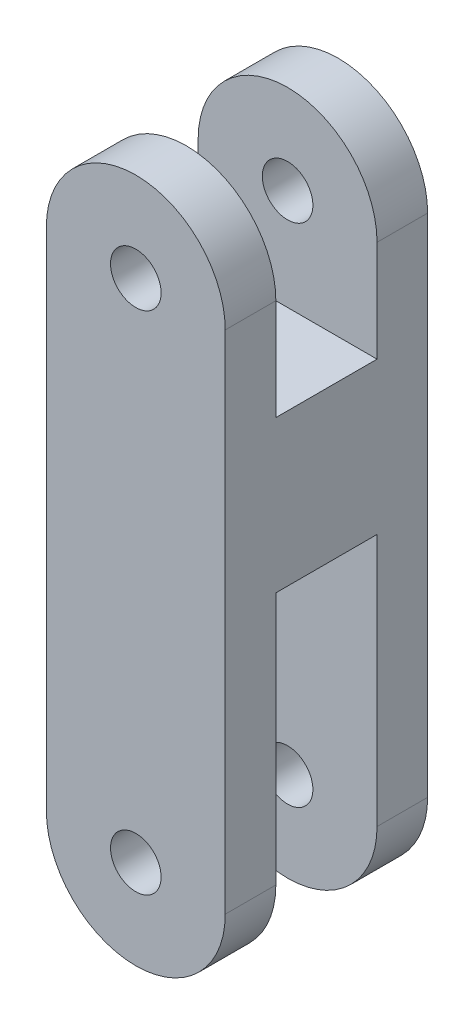
from build123d import *

# Parameters (mm, degrees)
BOSS_EXTRUDE2_DEPTH            = 40
BOSS_EXTRUDE2_DEPTH_BACK       = 40
SKETCH2_R                      = 10
CUT_EXTRUDE1_DEPTH             = 20
CUT_EXTRUDE1_DEPTH_BACK        = 20
CUT_EXTRUDE2_REACH             = 311.987
SKETCH4_W                      = 70.710678118
SKETCH4_H                      = 60
CUT_EXTRUDE2_DIRECTION_2_REACH = 311.987
SHELL1_START                   = -35
SHELL1_OUTLINE_W               = 60.710678118
SHELL1_OUTLINE_H               = 50
SHELL1_DEPTH                   = 70
SHELL1_2_OUTLINE_R             = 15
SHELL1_2_DEPTH                 = 10
SHELL1_START_2                 = 25
SHELL1_3_OUTLINE_R             = 15
SHELL1_3_DEPTH                 = 10


# Read off the part's stored shape, not the designer's step: Shell1
with BuildPart() as part:
    # Sketch2 → Boss-Extrude2 (new, two sides: drawn at the far end of the back side and taken through both)
    with BuildSketch(Plane.XY.offset(-BOSS_EXTRUDE2_DEPTH_BACK)):
        with BuildLine():
            Line((-35.355339059, -70), (-35.355339059, -270))
            ThreePointArc((-35.355339059, -270), (0, -305.355339059), (35.355339059, -270))
            Line((35.355339059, -270), (35.355339059, -70))
            ThreePointArc((35.355339059, -70), (0, -34.644660941), (-35.355339059, -70))
        make_face()
        with Locations((0, -70)):
            Circle(SKETCH2_R, mode=Mode.SUBTRACT)
        with Locations((0, -270)):
            Circle(SKETCH2_R, mode=Mode.SUBTRACT)
    extrude(amount=BOSS_EXTRUDE2_DEPTH + BOSS_EXTRUDE2_DEPTH_BACK)

    # Sketch3 → Cut-Extrude1 (cut, two sides: drawn at the far end of the back side and taken through both)
    with BuildSketch(Plane.XY.offset(-CUT_EXTRUDE1_DEPTH_BACK)):
        with BuildLine():
            Line((-35.355339059, -230), (35.355339059, -230))
            Line((35.355339059, -230), (35.355339059, -270))
            ThreePointArc((35.355339059, -270), (0, -305.355339059), (-35.355339059, -270))
            Line((-35.355339059, -270), (-35.355339059, -230))
        make_face()
        with BuildLine():
            Line((35.355339059, -110), (35.355339059, -70))
            ThreePointArc((35.355339059, -70), (0, -34.644660941), (-35.355339059, -70))
            Line((-35.355339059, -70), (-35.355339059, -110))
            Line((-35.355339059, -110), (35.355339059, -110))
        make_face()
    extrude(amount=CUT_EXTRUDE1_DEPTH + CUT_EXTRUDE1_DEPTH_BACK, mode=Mode.SUBTRACT)

    # Cut-Extrude2: up to this face of the body (flat: up to its plane)
    cut_extrude2_end = Plane(part.part.faces().sort_by_distance((-34.321974306, -250, -20))[0])
    # Sketch4 → Cut-Extrude2 (cut, up to the picked face)
    with BuildSketch(Plane.XY, mode=Mode.PRIVATE) as cut_extrude2_sk1:
        with Locations((0, -200)):
            Rectangle(SKETCH4_W, SKETCH4_H)
    cut_extrude2_tool1 = split(extrude(cut_extrude2_sk1.sketch, amount=-CUT_EXTRUDE2_REACH, mode=Mode.PRIVATE), bisect_by=cut_extrude2_end, keep=Keep.BOTH, mode=Mode.PRIVATE)
    add(cut_extrude2_tool1.solids().sort_by(Axis((0, -200, 0), (0, 0, -1)))[0], mode=Mode.SUBTRACT)

    # Cut-Extrude2 direction 2: up to this face of the body (flat: up to its plane)
    cut_extrude2_direction_2_end = Plane(part.part.faces().sort_by_distance((-34.321974306, -250, 20))[0])
    # Sketch4 → Cut-Extrude2 direction 2 (cut, up to the picked face)
    with BuildSketch(Plane.XY, mode=Mode.PRIVATE) as cut_extrude2_direction_2_sk1:
        with Locations((0, -200)):
            Rectangle(SKETCH4_W, SKETCH4_H)
    cut_extrude2_direction_2_tool1 = split(extrude(cut_extrude2_direction_2_sk1.sketch, amount=CUT_EXTRUDE2_DIRECTION_2_REACH, mode=Mode.PRIVATE), bisect_by=cut_extrude2_direction_2_end, keep=Keep.BOTH, mode=Mode.PRIVATE)
    add(cut_extrude2_direction_2_tool1.solids().sort_by(Axis((0, -200, 0), (0, 0, 1)))[0], mode=Mode.SUBTRACT)

    # Shell1 outline → Shell1 (cut)
    with BuildSketch(Plane.XY.offset(SHELL1_START)):
        with Locations((0, -140)):
            Rectangle(SHELL1_OUTLINE_W, SHELL1_OUTLINE_H)
    extrude(amount=SHELL1_DEPTH, mode=Mode.SUBTRACT)

    # Shell1 2 outline → Shell1 2 (cut)
    # profile 1 of 2: a face of its own
    with BuildSketch(Plane.XY.offset(SHELL1_START)):
        with BuildLine():
            ThreePointArc((-30.355339059, -270), (0, -300.355339059), (30.355339059, -270))
            Line((30.355339059, -270), (30.355339059, -165))
            Line((30.355339059, -165), (-30.355339059, -165))
            Line((-30.355339059, -165), (-30.355339059, -270))
        make_face()
        with Locations((0, -270)):
            Circle(SHELL1_2_OUTLINE_R, mode=Mode.SUBTRACT)
    # profile 2 of 2: a face of its own
    with BuildSketch(Plane.XY.offset(SHELL1_START)):
        with BuildLine():
            Line((-30.355339059, -115), (30.355339059, -115))
            Line((30.355339059, -115), (30.355339059, -70))
            ThreePointArc((30.355339059, -70), (0, -39.644660941), (-30.355339059, -70))
            Line((-30.355339059, -70), (-30.355339059, -115))
        make_face()
        with Locations((0, -70)):
            Circle(SHELL1_2_OUTLINE_R, mode=Mode.SUBTRACT)
    extrude(amount=SHELL1_2_DEPTH, mode=Mode.SUBTRACT)

    # Shell1 3 outline → Shell1 3 (cut)
    # profile 1 of 2: a face of its own
    with BuildSketch(Plane.XY.offset(SHELL1_START_2)):
        with BuildLine():
            ThreePointArc((-30.355339059, -270), (0, -300.355339059), (30.355339059, -270))
            Line((30.355339059, -270), (30.355339059, -165))
            Line((30.355339059, -165), (-30.355339059, -165))
            Line((-30.355339059, -165), (-30.355339059, -270))
        make_face()
        with Locations((0, -270)):
            Circle(SHELL1_3_OUTLINE_R, mode=Mode.SUBTRACT)
    # profile 2 of 2: a face of its own
    with BuildSketch(Plane.XY.offset(SHELL1_START_2)):
        with BuildLine():
            Line((-30.355339059, -115), (30.355339059, -115))
            Line((30.355339059, -115), (30.355339059, -70))
            ThreePointArc((30.355339059, -70), (0, -39.644660941), (-30.355339059, -70))
            Line((-30.355339059, -70), (-30.355339059, -115))
        make_face()
        with Locations((0, -70)):
            Circle(SHELL1_3_OUTLINE_R, mode=Mode.SUBTRACT)
    extrude(amount=SHELL1_3_DEPTH, mode=Mode.SUBTRACT)


solid = part.part
